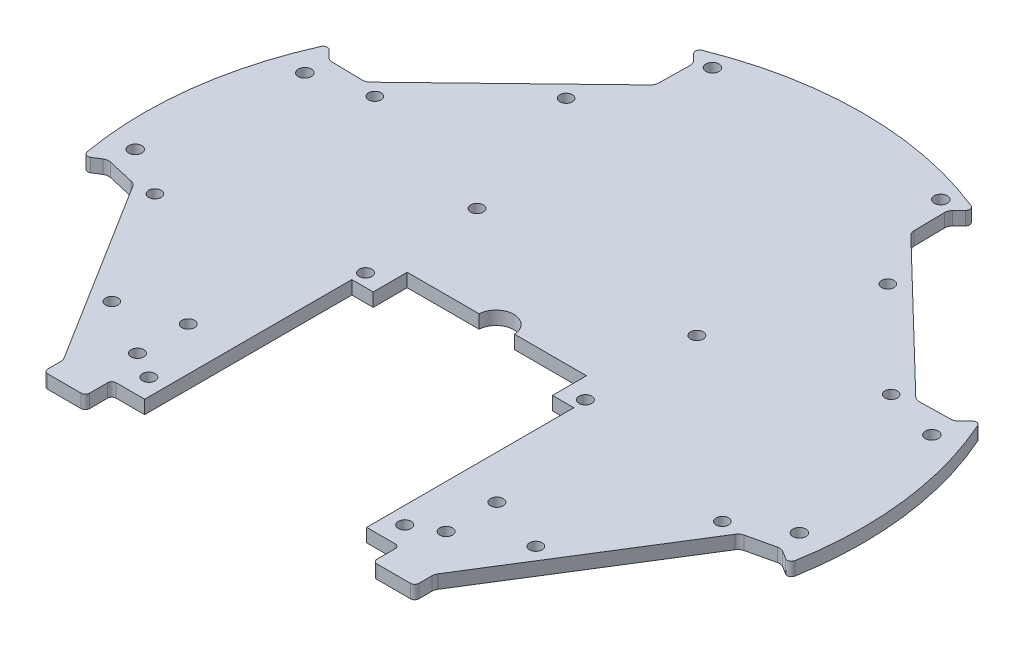
from build123d import *

# Parameters (mm, degrees)
BOSS_EXTRUDE4_DEPTH  = 1.5875
M3_CLEARANCE_HOLE3_D = 3
M3_CLEARANCE_HOLE1_D = 3.1
M3_CLEARANCE_HOLE4_D = 2.95
M3_CLEARANCE_HOLE2_D = 3.1
BOSS_EXTRUDE6_DEPTH  = 3.175
FILLET1_R            = 2
FILLET3_R            = 1
FILLET6_R            = 0.5
CUT_EXTRUDE4_DEPTH   = 10
SKETCH29_R           = 1.5
CUT_EXTRUDE5_DEPTH   = 10
SKETCH31_R           = 1.5
CUT_EXTRUDE7_DEPTH   = 10


with BuildPart() as part:
    # Sketch1 → Boss-Extrude4 (new, symmetric)
    with BuildSketch(Plane(origin=(0, 0, 0), x_dir=(1, 0, 0), z_dir=(0, 1, 0))):
        with BuildLine():
            Line((-62.799553621, 32.496136604), (-73.969425011, 32.691107434))
            Line((-73.969425011, 32.691107434), (-77.053684287, 35.88495141))
            ThreePointArc((-77.053684287, 35.88495141), (-84.36642289, 10.358894189), (-83.446216027, -16.178041625))
            Line((-83.446216027, -16.178041625), (-79.680911643, -13.825218315))
            Line((-79.680911643, -13.825218315), (-69.484649137, -16.179210996))
            Line((-69.484649137, -16.179210996), (-43.894490772, -57.132025032))
            Line((-43.894490772, -57.132025032), (-43.894490772, -64.826600275))
            Line((-43.894490772, -64.826600275), (-43.094490772, -64.826600275))
            Line((-43.094490772, -64.826600275), (-34, -64.826600275))
            Line((-34, -64.826600275), (-34, -59.55))
            Line((-34, -59.55), (-34, -58.55))
            Line((-34, -58.55), (-20, -58.55))
            Line((-20, -58.55), (-19.859459165, -59.55))
            Line((-19.859459165, -59.55), (19.859459165, -59.55))
            Line((19.859459165, -59.55), (20, -58.55))
            Line((20, -58.55), (34, -58.55))
            Line((34, -58.55), (34, -59.55))
            Line((34, -59.55), (34, -64.826600275))
            Line((34, -64.826600275), (43.094490772, -64.826600275))
            Line((43.094490772, -64.826600275), (43.894490772, -64.826600275))
            Line((43.894490772, -64.826600275), (43.894490772, -57.132025032))
            Line((43.894490772, -57.132025032), (69.484649137, -16.179210996))
            Line((69.484649137, -16.179210996), (79.680911643, -13.825218315))
            Line((79.680911643, -13.825218315), (83.446216027, -16.178041625))
            ThreePointArc((83.446216027, -16.178041625), (84.610662337, -8.126242604), (85, 0))
            ThreePointArc((85, 0), (82.98964744, 18.377116688), (77.053684287, 35.88495141))
            Line((77.053684287, 35.88495141), (73.969425011, 32.691107434))
            Line((73.969425011, 32.691107434), (62.799553621, 32.496136604))
            Line((62.799553621, 32.496136604), (30.284668021, 63.895396642))
            Line((30.284668021, 63.895396642), (30.089697191, 75.065268032))
            Line((30.089697191, 75.065268032), (33.173956467, 78.259112008))
            ThreePointArc((33.173956467, 78.259112008), (0, 85), (-33.173956467, 78.259112008))
            Line((-33.173956467, 78.259112008), (-30.089697191, 75.065268032))
            Line((-30.089697191, 75.065268032), (-30.284668021, 63.895396642))
            Line((-30.284668021, 63.895396642), (-62.799553621, 32.496136604))
        make_face()
    extrude(amount=BOSS_EXTRUDE4_DEPTH, both=True)

    # M3 Clearance Hole3 (through all)
    with Locations(Plane(origin=(0, -1.5875, 0), x_dir=(-1, 0, 0), z_dir=(0, -1, 0))):
        with Locations((36.5, -50), (36.5, -38), (-36.5, -50), (-36.5, -38)):
            Hole(M3_CLEARANCE_HOLE3_D / 2)

    # M3 Clearance Hole1 (through all)
    with Locations(Plane(origin=(0, 1.5875, 0), x_dir=(1, 0, 0), z_dir=(0, 1, 0))):
        with Locations((-78.542321426, -8.49139241), (78.542321426, -8.49139241), (74.155025063, 27.240269049), (-74.155025063, 27.240269049)):
            Hole(M3_CLEARANCE_HOLE1_D / 2)

    # M3 Clearance Hole4 (through all)
    with Locations(Plane(origin=(0, -1.5875, 0), x_dir=(-1, 0, 0), z_dir=(0, -1, 0))):
        with Locations((-67.099301622, -15.278865202), (-50.141885166, -42.416404279), (-61.062544382, 30.698137949), (-38.043670771, 52.927205804), (50.141885166, -42.416404279), (67.099301622, -15.278865202), (38.043670771, 52.927205804), (61.062544382, 30.698137949)):
            Hole(M3_CLEARANCE_HOLE4_D / 2)

    # M3 Clearance Hole2 (through all)
    with Locations(Plane(origin=(0, 1.5875, 0), x_dir=(1, 0, 0), z_dir=(0, 1, 0))):
        with Locations((27, 76.497766718), (-27, 76.497766718)):
            Hole(M3_CLEARANCE_HOLE2_D / 2)

    # Sketch22 → Boss-Extrude6 (add)
    with BuildSketch(Plane(origin=(0, 1.5875, 0), x_dir=(1, 0, 0), z_dir=(0, 1, 0))):
        Polygon((65.061950694, 32.535626892), (30.245177733, 66.157793715), (30.284668021, 63.895396642), (62.799553621, 32.496136604), align=None)
        Polygon((-30.284668021, 63.895396642), (-30.245177733, 66.157793715), (-65.061950694, 32.535626892), (-62.799553621, 32.496136604), align=None)
        Polygon((43.894490772, -60.151352895), (71.689396914, -15.670204865), (69.484649137, -16.179210996), (43.894490772, -57.132025032), align=None)
        Polygon((-69.484649137, -16.179210996), (-71.689396914, -15.670204865), (-43.894490772, -60.151352895), (-43.894490772, -57.132025032), align=None)
    extrude(amount=-BOSS_EXTRUDE6_DEPTH)

    # Fillet1
    fillet1_edges = [part.edges().sort_by_distance(p)[0] for p in [
        (-30.245177733, 0.79375, -66.157793715),
        (-65.061950694, 0.79375, -32.535626892),
        (-71.689396914, 0.79375, 15.670204865),
        (-43.894490772, 0.79375, 60.151352895),
        (43.894490772, -0.79375, 60.151352895),
        (71.689396914, -0.79375, 15.670204865),
        (65.061950694, 0.79375, -32.535626892),
        (30.245177733, -0.79375, -66.157793715),
        (30.089697191, -0.79375, -75.065268032),
        (73.969425011, -0.79375, -32.691107434),
        (79.680911643, -0.79375, 13.825218315),
        (-79.680911643, -0.79375, 13.825218315),
        (-73.969425011, -0.79375, -32.691107434),
        (-30.089697191, -0.79375, -75.065268032),
    ]]
    fillet(fillet1_edges, radius=FILLET1_R)

    # Fillet3
    fillet3_edges = [part.edges().sort_by_distance(p)[0] for p in [
        (33.173956467, -0.79375, -78.259112008),
        (77.053684287, 0.79375, -35.88495141),
        (83.446216027, -0.79375, 16.178041625),
        (43.894490772, -0.79375, 64.826600275),
        (34, 0.79375, 64.826600275),
        (34, -0.79375, 58.55),
        (-34, -0.79375, 58.55),
        (-34, 0.79375, 64.826600275),
        (-43.894490772, -0.79375, 64.826600275),
        (-83.446216027, -0.79375, 16.178041625),
        (-77.053684287, -0.79375, -35.88495141),
        (-33.173956467, -0.79375, -78.259112008),
    ]]
    fillet(fillet3_edges, radius=FILLET3_R - 0.0001)  # a hair under: the kernel refuses the full size

    # Fillet6
    fillet6_edges = [part.edges().sort_by_distance(p)[0] for p in [
        (20, -0.79375, 58.55),
        (19.859459165, -0.79375, 59.55),
        (-19.859459165, 0.79375, 59.55),
        (-20, 0.79375, 58.55),
    ]]
    fillet(fillet6_edges, radius=FILLET6_R)

    # Sketch28 → Cut-Extrude4 (cut)
    with BuildSketch(Plane(origin=(0, 1.5875, 0), x_dir=(1, 0, 0), z_dir=(0, 1, 0))):
        with BuildLine():
            Line((-26.25, -9.55), (-26.25, -59.55))
            Line((-26.25, -59.55), (26.25, -59.55))
            Line((26.25, -59.55), (26.25, -9.55))
            Line((26.25, -9.55), (21.2, -9.55))
            Line((21.2, -9.55), (21.2, -1.5))
            Line((21.2, -1.5), (4.195235393, -1.5))
            ThreePointArc((4.195235393, -1.5), (0, 2.5), (-4.195235393, -1.5))
            Line((-4.195235393, -1.5), (-21.2, -1.5))
            Line((-21.2, -1.5), (-21.2, -9.55))
            Line((-21.2, -9.55), (-26.25, -9.55))
        make_face()
    extrude(amount=-CUT_EXTRUDE4_DEPTH, mode=Mode.SUBTRACT)

    # Sketch29 → Cut-Extrude5 (cut)
    with BuildSketch(Plane(origin=(0, 1.5875, 0), x_dir=(1, 0, 0), z_dir=(0, 1, 0))):
        with Locations(Location((30.25, -53.55, 0), (0, 0, 270))):
            Circle(SKETCH29_R)
        with Locations(Location((-30.25, -53.55, 0), (0, 0, 270))):
            Circle(SKETCH29_R)
    extrude(amount=-CUT_EXTRUDE5_DEPTH, mode=Mode.SUBTRACT)

    # Sketch31 → Cut-Extrude7 (cut)
    with BuildSketch(Plane(origin=(0, 1.5875, 0), x_dir=(1, 0, 0), z_dir=(0, 1, 0))):
        with Locations(Location((-26, -6.55, 0), (0, 0, 270))):
            Circle(SKETCH31_R)
        with Locations(Location((26, -6.55, 0), (0, 0, 270))):
            Circle(SKETCH31_R)
        with Locations(Location((-26, 19.8, 0), (0, 0, 270))):
            Circle(SKETCH31_R)
        with Locations(Location((26, 19.8, 0), (0, 0, 270))):
            Circle(SKETCH31_R)
    extrude(amount=-CUT_EXTRUDE7_DEPTH, mode=Mode.SUBTRACT)


solid = part.part
